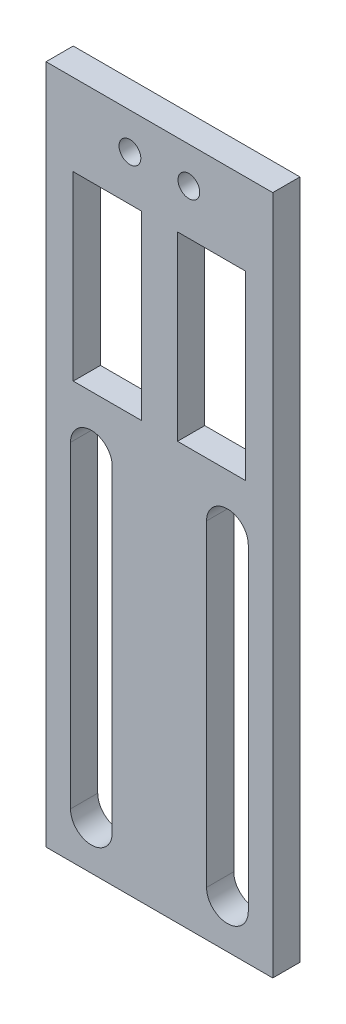
from build123d import *

# Parameters (mm, degrees)
SKETCH1_W           = 25
SKETCH1_H           = 75
BOSS_EXTRUDE1_DEPTH = 3
SKETCH2_R           = 1.2
SKETCH2_W           = 7.5
SKETCH2_H           = 20
CUT_EXTRUDE1_DEPTH  = 40.642149286


with BuildPart() as part:
    # Sketch1 → Boss-Extrude1 (new body)
    with BuildSketch(Plane.XY):
        Rectangle(SKETCH1_W, SKETCH1_H)
    extrude(amount=BOSS_EXTRUDE1_DEPTH)

    # Sketch2 → Cut-Extrude1 (cut, through all)
    with BuildSketch(Plane.XY.offset(3)):
        with Locations((-3.25, 33.5)):
            Circle(SKETCH2_R)
        with Locations((3.25, 33.5)):
            Circle(SKETCH2_R)
        with Locations((-5.75, 18.5)):
            Rectangle(SKETCH2_W, SKETCH2_H)
        with Locations((5.75, 18.5)):
            Rectangle(SKETCH2_W, SKETCH2_H)
        with BuildLine():
            Line((-9.8, -32.5), (-9.8, 2.5))
            ThreePointArc((-9.8, 2.5), (-7.5, 4.8), (-5.2, 2.5))
            Line((-5.2, 2.5), (-5.2, -32.5))
            ThreePointArc((-5.2, -32.5), (-7.5, -34.8), (-9.8, -32.5))
        make_face()
        with BuildLine():
            Line((5.2, -32.5), (5.2, 2.5))
            ThreePointArc((5.2, 2.5), (7.5, 4.8), (9.8, 2.5))
            Line((9.8, 2.5), (9.8, -32.5))
            ThreePointArc((9.8, -32.5), (7.5, -34.8), (5.2, -32.5))
        make_face()
    extrude(amount=-CUT_EXTRUDE1_DEPTH, mode=Mode.SUBTRACT)


solid = part.part
